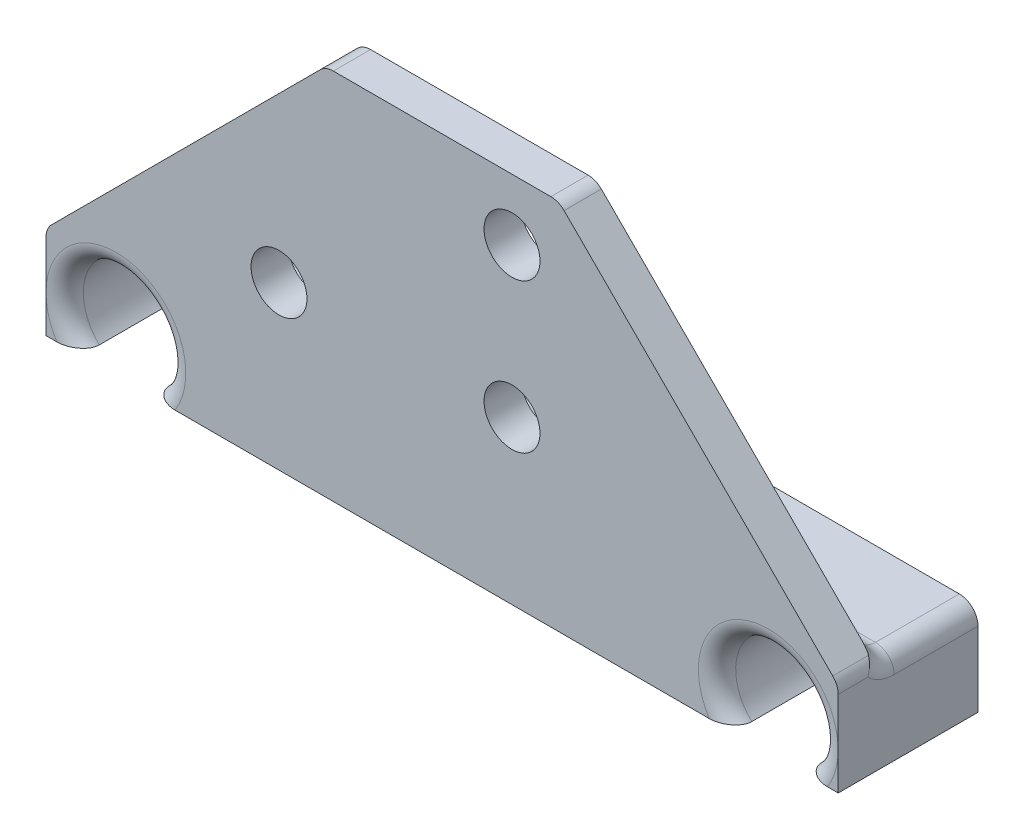
from build123d import *

# Parameters (mm, degrees)
SKETCH1_W           = 85
SKETCH1_H           = 10
BOSS_EXTRUDE1_DEPTH = 15
SKETCH3_R           = 2.292918
CUT_EXTRUDE1_DEPTH  = 100
LPATTERN1_COUNT     = 2
LPATTERN1_PITCH     = 70
SKETCH7_W           = 85
SKETCH7_H           = 4
BOSS_EXTRUDE5_DEPTH = 30
SKETCH8_R           = 3
CUT_EXTRUDE2_DEPTH  = 25
LPATTERN2_START     = 11
LPATTERN2_OUTLINE_R = 3
LPATTERN2_DEPTH     = 4
CHAMFER2_SIZE       = 30
FILLET3_START       = -1
FILLET3_DEPTH       = 10
FILLET3_START_2     = 1.5411
FILLET3_2_DEPTH     = 14.4589
FILLET3_START_3     = 9
FILLET3_3_DEPTH     = 2.164784
FILLET3_5_DEPTH     = 2
FILLET3_START_4     = 11
FILLET3_6_OUTLINE_R = 3
FILLET3_6_DEPTH     = 0.164784
SKETCH9_R           = 5.5
CUT_EXTRUDE7_DEPTH  = 11
LPATTERN3_COUNT     = 2
LPATTERN3_PITCH     = 70
CHAMFER3_SIZE       = 3
FILLET4_R           = 2


with BuildPart() as part:
    # Sketch1 → Boss-Extrude1 (new body)
    with BuildSketch(Plane.XY):
        Rectangle(SKETCH1_W, SKETCH1_H)
    extrude(amount=BOSS_EXTRUDE1_DEPTH)

    # Sketch3 → Cut-Extrude1 (cut)
    with BuildSketch(Plane.XY.offset(15)):
        with Locations((-35, -1)):
            Circle(SKETCH3_R)
    cut_extrude1 = extrude(amount=-CUT_EXTRUDE1_DEPTH, mode=Mode.SUBTRACT)

    # LPattern1: Cut-Extrude1 ×2
    with Locations(*[(i * LPATTERN1_PITCH, 0, 0) for i in range(1, LPATTERN1_COUNT)]):
        add(cut_extrude1, mode=Mode.SUBTRACT)

    # Sketch7 → Boss-Extrude5 (add)
    with BuildSketch(Plane(origin=(0, 5, 0), x_dir=(1, 0, 0), z_dir=(0, 1, 0))):
        with Locations((0, -13)):
            Rectangle(SKETCH7_W, SKETCH7_H)
    extrude(amount=BOSS_EXTRUDE5_DEPTH)

    # Sketch8 → Cut-Extrude2 (cut)
    with BuildSketch(Plane.XY.offset(15)):
        with Locations((7.5, 12.421962)):
            Circle(SKETCH8_R)
    extrude(amount=-CUT_EXTRUDE2_DEPTH, mode=Mode.SUBTRACT)

    # LPattern2: read off the stored shape, not the designer's step
    # LPattern2 outline → LPattern2 (cut)
    with BuildSketch(Plane.XY.offset(LPATTERN2_START)):
        with Locations((-17.5, 12.421962)):
            Circle(LPATTERN2_OUTLINE_R)
        with Locations((7.5, 28.421962)):
            Circle(LPATTERN2_OUTLINE_R)
    extrude(amount=LPATTERN2_DEPTH, mode=Mode.SUBTRACT)

    # Chamfer2
    chamfer2_edges = [part.edges().sort_by_distance(p)[0] for p in [
        (42.5, 35, 13),
        (-42.5, 35, 13),
    ]]
    chamfer(chamfer2_edges, length=CHAMFER2_SIZE)

    # Fillet3: read off the stored shape, not the designer's step
    # Fillet3 outline → Fillet3 (cut)
    with BuildSketch(Plane.XY.offset(FILLET3_START)):
        with BuildLine():
            ThreePointArc((40.5, 5), (41.914214, 4.414214), (42.5, 3))
            Line((42.5, 3), (42.5, 5))
            Line((42.5, 5), (40.5, 5))
        make_face()
        with BuildLine():
            ThreePointArc((-42.5, 3), (-41.914214, 4.414214), (-40.5, 5))
            Line((-40.5, 5), (-42.5, 5))
            Line((-42.5, 5), (-42.5, 3))
        make_face()
    extrude(amount=FILLET3_DEPTH, mode=Mode.SUBTRACT)

    # Fillet3 2 outline → Fillet3 2 (cut)
    with BuildSketch(Plane.XY.offset(FILLET3_START_2)):
        with BuildLine():
            Line((42.5, 4.171573), (42.5, 5))
            Line((42.5, 5), (41.914214, 5.585786))
            ThreePointArc((41.914214, 5.585786), (42.347759, 4.93694), (42.5, 4.171573))
        make_face()
        with BuildLine():
            Line((-41.914214, 5.585786), (-42.5, 5))
            Line((-42.5, 5), (-42.5, 4.171573))
            ThreePointArc((-42.5, 4.171573), (-42.347759, 4.93694), (-41.914214, 5.585786))
        make_face()
        with BuildLine():
            ThreePointArc((11.671573, 35), (12.43694, 34.847759), (13.085786, 34.414214))
            Line((13.085786, 34.414214), (12.5, 35))
            Line((12.5, 35), (11.671573, 35))
        make_face()
        with BuildLine():
            Line((-12.5, 35), (-13.085786, 34.414214))
            ThreePointArc((-13.085786, 34.414214), (-12.43694, 34.847759), (-11.671573, 35))
            Line((-11.671573, 35), (-12.5, 35))
        make_face()
    extrude(amount=FILLET3_2_DEPTH, mode=Mode.SUBTRACT)

    # Fillet3 3 outline → Fillet3 3 (add)
    with BuildSketch(Plane.XY.offset(FILLET3_START_3)):
        with BuildLine():
            Line((-42.320359, 5), (42.320359, 5))
            ThreePointArc((42.320359, 5), (42.143594, 5.311133), (41.914214, 5.585786))
            Line((41.914214, 5.585786), (13.085786, 34.414214))
            ThreePointArc((13.085786, 34.414214), (12.43694, 34.847759), (11.671573, 35))
            Line((11.671573, 35), (-11.671573, 35))
            ThreePointArc((-11.671573, 35), (-12.43694, 34.847759), (-13.085786, 34.414214))
            Line((-13.085786, 34.414214), (-41.914214, 5.585786))
            ThreePointArc((-41.914214, 5.585786), (-42.143594, 5.311133), (-42.320359, 5))
        make_face()
    extrude(amount=FILLET3_3_DEPTH)

    # Fillet3 4 outline → Fillet3 4 (revolve, cut)
    with BuildSketch(Plane(origin=(0, 7, 9), x_dir=(0, 1, 0), z_dir=(0, 0, -1))):
        with BuildLine():
            Line((4, 42.5), (0, 42.5))
            Line((0, 42.5), (0, -42.5))
            Line((0, -42.5), (4, -42.5))
            ThreePointArc((4, -42.5), (2.585786, -41.914214), (2, -40.5))
            Line((2, -40.5), (2, 40.5))
            ThreePointArc((2, 40.5), (2.585786, 41.914214), (4, 42.5))
        make_face()
    revolve(axis=Axis((0, 7, 9), (1, 0, 0)), mode=Mode.SUBTRACT)

    # Fillet3 5 outline → Fillet3 5 (cut)
    with BuildSketch(Plane.XY.offset(FILLET3_START_3)):
        with BuildLine():
            Line((11.671573, 35), (-11.671573, 35))
            ThreePointArc((-11.671573, 35), (-12.43694, 34.847759), (-13.085786, 34.414214))
            Line((-13.085786, 34.414214), (-40.5, 7))
            Line((-40.5, 7), (40.5, 7))
            Line((40.5, 7), (13.085786, 34.414214))
            ThreePointArc((13.085786, 34.414214), (12.43694, 34.847759), (11.671573, 35))
        make_face()
    extrude(amount=FILLET3_5_DEPTH, mode=Mode.SUBTRACT)

    # Fillet3 6 outline → Fillet3 6 (cut)
    with BuildSketch(Plane.XY.offset(FILLET3_START_4)):
        with Locations((7.5, 28.421962)):
            Circle(FILLET3_6_OUTLINE_R)
        with Locations((7.5, 12.421962)):
            Circle(FILLET3_6_OUTLINE_R)
        with Locations((-17.5, 12.421962)):
            Circle(FILLET3_6_OUTLINE_R)
    extrude(amount=FILLET3_6_DEPTH, mode=Mode.SUBTRACT)

    # Sketch9 → Cut-Extrude7 (cut)
    with BuildSketch(Plane.XY.offset(15)):
        with Locations((-35, -1)):
            Circle(SKETCH9_R)
    cut_extrude7 = extrude(amount=-CUT_EXTRUDE7_DEPTH, mode=Mode.SUBTRACT)

    # LPattern3: Cut-Extrude7 ×2
    with Locations(*[(i * LPATTERN3_PITCH, 0, 0) for i in range(1, LPATTERN3_COUNT)]):
        add(cut_extrude7, mode=Mode.SUBTRACT)

    # Chamfer3
    # the kernel refuses this chamfer: 3 mm, written as the material it takes off along each edge
    with BuildSketch(Plane(origin=(-35, -1, 4), x_dir=(1, 0, 0), z_dir=(0, -1, 0))) as chamfer3_piece_1:
        Polygon((2.292918 + CHAMFER3_SIZE, 0), (2.292918, -CHAMFER3_SIZE), (2.292918, 0), align=None)
    revolve(axis=Axis((-35, -1, 4), (0, 0, 1)), mode=Mode.SUBTRACT)
    with BuildSketch(Plane(origin=(35, -1, 4), x_dir=(1, 0, 0), z_dir=(0, -1, 0))) as chamfer3_piece_2:
        Polygon((2.292918 + CHAMFER3_SIZE, 0), (2.292918, -CHAMFER3_SIZE), (2.292918, 0), align=None)
    revolve(axis=Axis((35, -1, 4), (0, 0, 1)), mode=Mode.SUBTRACT)

    # Fillet4
    fillet4_edges = [part.edges().sort_by_distance(p)[0] for p in [
        (-35, 4.5, 15),
        (35, 4.5, 15),
    ]]
    fillet(fillet4_edges, radius=FILLET4_R - 0.0001)  # a hair under: the kernel refuses the full size


solid = part.part
